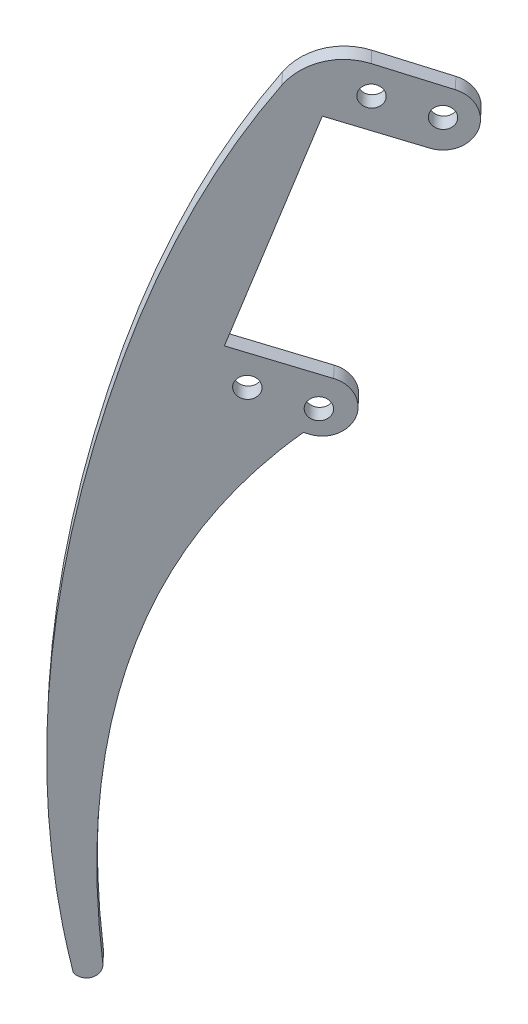
from build123d import *

# Parameters (mm, degrees)
BOSS_EXTRUDE1_DEPTH        = 3
CUT_EXTRUDE1_DEPTH         = 252.974914731
M3_5_CLEARANCE_HOLE1_D     = 3.81
M3_5_CLEARANCE_HOLE1_DEPTH = 33.326039541
FILLET3_R                  = 10
FILLET4_R                  = 4.953107
FILLET10_RADIUS            = 4.717615086
FILLET10_LENGTH            = 3


with BuildPart() as part:
    # Sketch1 → Boss-Extrude1 (new body)
    with BuildSketch(Plane(origin=(-18.747425911, 0, -19.797474517), x_dir=(0, 1, 0), z_dir=(0.6875885279992334, -2.359310851515896e-15, 0.7261005551325845))):
        with BuildLine():
            Line((47.134672347, 186.593127271), (102.029433509, 167.605742926))
            Line((102.029433509, 167.605742926), (110.11778873, 189.999917885))
            add(Edge.make_bspline(
                [(110.11778873, 189.999917885), (95.556778138, 201.958306819), (77.203961524, 210.173231356), (27.942477706, 224.856027605), (-5.55144569, 228.347913352), (-37.305127188, 221.679998311)],
                knots=[0.208168369, 0.208168369, 0.208168369, 0.208168369, 0.5, 0.5, 1, 1, 1, 1], degree=3))
            ThreePointArc((-37.305127188, 221.679998311), (-37.947282057, 219.208911383), (-35.783847857, 217.85311422))
            add(Edge.make_bspline(
                [(48.961630736, 191.875078834), (21.255996477, 223.260445978), (-35.783847857, 217.85311422)],
                knots=[3.106185015, 3.106185015, 3.106185015, 3.3708584, 3.3708584, 3.3708584], degree=2, weights=[1, 0.991256272, 1]))
            Line((48.961630736, 191.875078834), (47.134672347, 186.593127271))
        make_face()
    extrude(amount=-BOSS_EXTRUDE1_DEPTH)

    # Sketch2 → Cut-Extrude1 (cut, through all)
    with BuildSketch(Plane(origin=(-20.810191495, 0, -21.975776182), x_dir=(-0.7261005551325845, -2.234174129215775e-15, 0.6875885279992334), z_dir=(-0.6875885279992334, 2.3593108515158963e-15, -0.7261005551325845))):
        Polygon((170.822075884, 92.730636669), (183.50888872, 56.051568722), (202.112473576, 62.486306908), (189.42566074, 99.165374855), align=None)
    extrude(amount=-CUT_EXTRUDE1_DEPTH, mode=Mode.SUBTRACT)

    # M3.5 Clearance Hole1
    with Locations(Plane(origin=(-18.747425911, 0, -19.797474517), x_dir=(0.7261005551325845, 2.234174129215775e-15, -0.6875885279992334), z_dir=(0.6875885279992334, -2.3593108515158963e-15, 0.7261005551325845))):
        with Locations((-183.058820464, 102.459409082), (-199.141514485, 55.962449256), (-189.875728995, 52.757534495), (-173.793034975, 99.254494321)):
            Hole(M3_5_CLEARANCE_HOLE1_D / 2, depth=M3_5_CLEARANCE_HOLE1_DEPTH)

    # Fillet3
    fillet3_edges = [part.edges().sort_by_distance(p)[0] for p in [
        (-157.737854554, 110.11778873, 109.755138509),
    ]]
    fillet(fillet3_edges, radius=FILLET3_R)

    # Fillet4
    fillet4_edges = [part.edges().sort_by_distance(p)[0] for p in [
        (-141.477431685, 102.029433509, 94.357160713),
        (-143.812812831, 92.730636669, 96.568674357),
    ]]
    fillet(fillet4_edges, radius=FILLET4_R - 0.0001)  # a hair under: the kernel refuses the full size

    # Fillet10: full round fillet: the end face becomes a half cylinder, R = half its width
    fillet10_face = Plane((-154.144448336, 51.593120535, 106.352324843), x_dir=(-0.687588527999, 0, -0.726100555133), z_dir=(0.686211495613, -0.326885353607, -0.649815165171))  # on the end face: x along it, z out of the body
    fillet10_slab = fillet10_face.offset(-FILLET10_RADIUS / 2) * Box(FILLET10_LENGTH, 2 * FILLET10_RADIUS, FILLET10_RADIUS, mode=Mode.PRIVATE)  # the body's end, R deep
    fillet10_round = Plane((-157.38173004, 53.135239811, 109.417902669), x_dir=(0.686211495613, -0.326885353607, -0.649815165171), z_dir=(-0.687588527999, 0, -0.726100555133)) * Cylinder(FILLET10_RADIUS, FILLET10_LENGTH, mode=Mode.PRIVATE)  # its axis R under the face
    add(fillet10_slab - fillet10_round, mode=Mode.SUBTRACT)


solid = part.part
